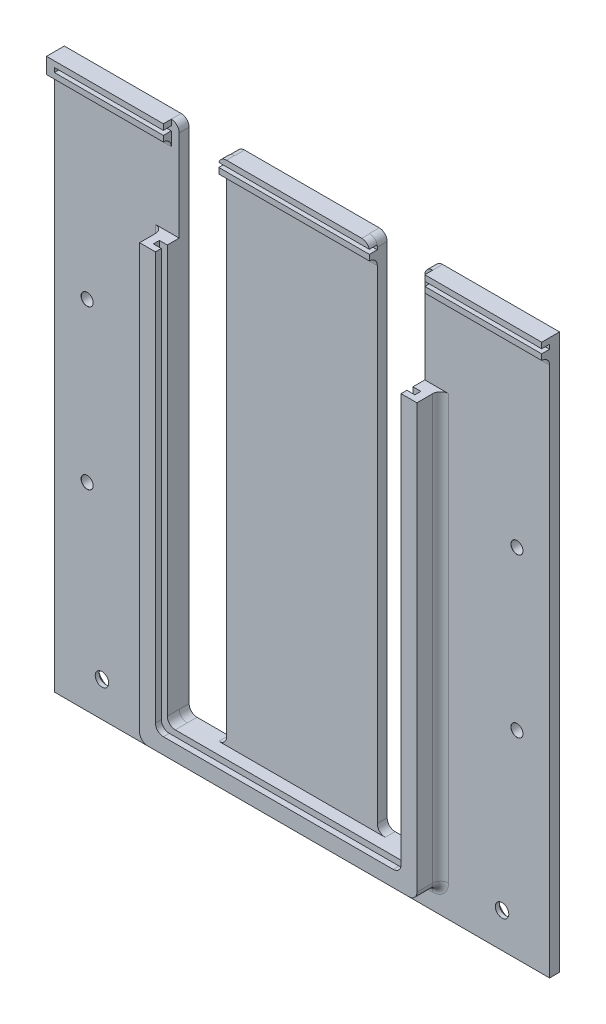
from build123d import *

# Parameters (mm, degrees)
ESBO_O1_W                                    = 125
ESBO_O1_H                                    = 140
RESSALTO_EXTRUS_O1_DEPTH                     = 2.5
RESSALTO_EXTRUS_O2_DEPTH                     = 6
ESBO_O3_W                                    = 1.52
ESBO_O3_H                                    = 105
CORTE_EXTRUS_O1_DEPTH                        = 2
ESBO_O4_W                                    = 1.52
ESBO_O4_H                                    = 105
CORTE_EXTRUS_O2_DEPTH                        = 2
ESBO_O5_W                                    = 66
ESBO_O5_H                                    = 1.52
CORTE_EXTRUS_O3_DEPTH                        = 2
FILETE1_R                                    = 2
FILETE2_R                                    = 2
FILETE3_R                                    = 2
ESBO_O6_W                                    = 12
ESBO_O6_H                                    = 130
CORTE_EXTRUS_O4_DEPTH                        = 138.929522592
FILETE4_R                                    = 2
FILETE5_R                                    = 2
ESBO_O7_W                                    = 19.009766083
ESBO_O7_H                                    = 4
ESBO_O7_W_2                                  = 19
ESBO_O7_W_3                                  = 29.5
RESSALTO_EXTRUS_O3_DEPTH                     = 2
ESBO_O8_W                                    = 123
ESBO_O8_H                                    = 1.1
CORTE_EXTRUS_O5_DEPTH                        = 2
FILETE6_R                                    = 2
FUROS_GUIA_COM_3_0MM1_D                      = 3
FUROS_GUIA_COM_3_0MM1_CSINK_D                = 3.05
FUROS_GUIA_COM_3_0MM1_CSINK_ANGLE            = 90
REBAIXO_PARA_PARAFUSO_COM_CABE_A_PAN_2_COUNT = 2
REBAIXO_PARA_PARAFUSO_COM_CABE_A_PAN_2_PITCH = 101


with BuildPart() as part:
    # Esboço1 → Ressalto-extrusão1 (new body)
    with BuildSketch(Plane.XY):
        with Locations((10.140586838, -47.097815293)):
            Rectangle(ESBO_O1_W, ESBO_O1_H)
    extrude(amount=RESSALTO_EXTRUS_O1_DEPTH)

    # Esboço2 → Ressalto-extrusão2 (add)
    with BuildSketch(Plane.XY.offset(2.5)):
        Polygon((-24.859413162, -2.097815293), (-20.859413162, -2.097815293), (-20.859413162, -107.097815293), (41.140586838, -107.097815293), (41.140586838, -2.097815293), (45.140586838, -2.097815293), (45.140586838, -107.097815293), (45.140586838, -111.097815293), (-24.859413162, -111.097815293), (-24.859413162, -107.097815293), align=None)
    extrude(amount=RESSALTO_EXTRUS_O2_DEPTH)

    # Esboço3 → Corte-extrusão1 (cut)
    with BuildSketch(Plane.ZY.offset(-41.140586838)):
        with Locations((6.26, -54.597815293)):
            Rectangle(ESBO_O3_W, ESBO_O3_H)
    extrude(amount=-CORTE_EXTRUS_O1_DEPTH, mode=Mode.SUBTRACT)

    # Esboço4 → Corte-extrusão2 (cut)
    with BuildSketch(Plane(origin=(-20.859413162, 0, 0), x_dir=(0, 0, -1), z_dir=(1, 0, 0))):
        with Locations((-6.26, -54.597815293)):
            Rectangle(ESBO_O4_W, ESBO_O4_H)
    extrude(amount=-CORTE_EXTRUS_O2_DEPTH, mode=Mode.SUBTRACT)

    # Esboço5 → Corte-extrusão3 (cut)
    with BuildSketch(Plane(origin=(0, -107.097815293, 0), x_dir=(1, 0, 0), z_dir=(0, 1, 0))):
        with Locations((10.140586838, -6.26)):
            Rectangle(ESBO_O5_W, ESBO_O5_H)
    extrude(amount=-CORTE_EXTRUS_O3_DEPTH, mode=Mode.SUBTRACT)

    # Filete1
    filete1_edges = [part.edges().sort_by_distance(p)[0] for p in [
        (41.140586838, -107.097815293, 7.76),
        (-20.859413162, -107.097815293, 7.76),
        (41.140586838, -107.097815293, 4),
        (-20.859413162, -107.097815293, 4),
    ]]
    fillet(filete1_edges, radius=FILETE1_R)

    # Filete2
    filete2_edges = [part.edges().sort_by_distance(p)[0] for p in [
        (-24.859413162, -111.097815293, 5.5),
        (45.140586838, -111.097815293, 5.5),
    ]]
    fillet(filete2_edges, radius=FILETE2_R)

    # Filete3
    filete3_edges = [part.edges().sort_by_distance(p)[0] for p in [
        (10.140586838, -111.097815293, 2.5),
        (-24.273626724, -110.512028855, 2.5),
        (44.5548004, -110.512028855, 2.5),
        (-24.859413162, -55.597815293, 2.5),
        (45.140586838, -55.597815293, 2.5),
    ]]
    fillet(filete3_edges, radius=FILETE3_R)

    # Esboço6 → Corte-extrusão4 (cut, through all)
    with BuildSketch(Plane.XY.offset(2.5)):
        with Locations((-14.859413162, -42.097815293)):
            Rectangle(ESBO_O6_W, ESBO_O6_H)
        with Locations((35.140586838, -42.097815293)):
            Rectangle(ESBO_O6_W, ESBO_O6_H)
    extrude(amount=-CORTE_EXTRUS_O4_DEPTH, mode=Mode.SUBTRACT)

    # Filete4
    filete4_edges = [part.edges().sort_by_distance(p)[0] for p in [
        (-20.859413162, 22.902184707, 1.25),
        (-8.859413162, 22.902184707, 1.25),
        (41.140586838, 22.902184707, 1.25),
        (29.140586838, 22.902184707, 1.25),
    ]]
    fillet(filete4_edges, radius=FILETE4_R)

    # Filete5
    filete5_edges = [part.edges().sort_by_distance(p)[0] for p in [
        (-20.859413162, -107.097815293, 1.25),
        (-8.859413162, -107.097815293, 1.25),
        (41.140586838, -107.097815293, 1.25),
        (29.140586838, -107.097815293, 1.25),
    ]]
    fillet(filete5_edges, radius=FILETE5_R)

    # Esboço7 → Ressalto-extrusão3 (add)
    with BuildSketch(Plane.XY.offset(2.5)):
        with Locations((0.635703797, 20.902184707)):
            Rectangle(ESBO_O7_W, ESBO_O7_H)
        with Locations((19.640586838, 20.902184707)):
            Rectangle(ESBO_O7_W_2, ESBO_O7_H)
        with Locations((-37.609413162, 20.902184707)):
            Rectangle(ESBO_O7_W_3, ESBO_O7_H)
        with Locations((57.890586838, 20.902184707)):
            Rectangle(ESBO_O7_W_3, ESBO_O7_H)
    extrude(amount=RESSALTO_EXTRUS_O3_DEPTH)

    # Esboço8 → Corte-extrusão5 (cut)
    with BuildSketch(Plane.XY.offset(4.5)):
        with Locations((11.140586838, 20.902184707)):
            Rectangle(ESBO_O8_W, ESBO_O8_H)
    extrude(amount=-CORTE_EXTRUS_O5_DEPTH, mode=Mode.SUBTRACT)

    # Filete6
    # the kernel refuses this fillet: 2 mm, written as the material it adds along each edge
    with BuildSketch(Plane(origin=(43.140586838, 18.902184707, 2.5), x_dir=(0, 0, 1), z_dir=(1, 0, 0)), Plane(origin=(-52.359413162, 18.902184707, 2.5), x_dir=(0, 0, 1), z_dir=(1, 0, 0))) as filete6_piece_1:
        with BuildLine():
            CenterArc((FILETE6_R, FILETE6_R), FILETE6_R, 180, 90)
            Line((0, FILETE6_R), (0, 0))
            Line((0, 0), (FILETE6_R, 0))
        make_face()
    extrude(amount=29.5)
    with BuildSketch(Plane(origin=(29.140586838, 18.902184707, 2.5), x_dir=(0, 0, 1), z_dir=(-1, 0, 0))) as filete6_piece_2:
        with BuildLine():
            CenterArc((FILETE6_R, -FILETE6_R), FILETE6_R, 90, 90)
            Line((0, -FILETE6_R), (0, 0))
            Line((0, 0), (FILETE6_R, 0))
        make_face()
    extrude(amount=38)
    # the kernel refuses this fillet: 2 mm, written as the material it takes off along each edge
    with BuildSketch(Plane(origin=(29.140586838, 22.902184707, -2.307221131), x_dir=(-1, 0, 0), z_dir=(0, 0, 1))) as filete6_2_piece_1:
        with BuildLine():
            CenterArc((1.922888452, 2), FILETE6_R, 195.962014163, 74.037985837)
            Line((0, 1.45), (0, 0))
            Line((0, 0), (1.922888452, 0))
        make_face()
    extrude(amount=11.614442262, mode=Mode.SUBTRACT)
    with BuildSketch(Plane(origin=(-8.869179245, 22.902184707, -2.307221131), x_dir=(1, 0, 0), z_dir=(0, 0, 1))) as filete6_2_piece_2:
        with BuildLine():
            CenterArc((1.922888452, -2), FILETE6_R, 90, 74.037985837)
            Line((0, -1.45), (0, 0))
            Line((0, 0), (1.922888452, 0))
        make_face()
    extrude(amount=11.614442262, mode=Mode.SUBTRACT)

    # Furos-guia com Ø3.0mm1 (through all)
    with Locations(Plane.XY.offset(2.5)):
        with Locations((-44.109413162, -27.097815293), (-44.109413162, -67.097815293), (64.390586838, -27.094030717), (64.390586838, -67.094030814)):
            CounterSinkHole(FUROS_GUIA_COM_3_0MM1_D / 2, FUROS_GUIA_COM_3_0MM1_CSINK_D / 2, counter_sink_angle=FUROS_GUIA_COM_3_0MM1_CSINK_ANGLE)

    # Esboço14 → Rebaixo para parafuso com cabeça panela de M31 (revolve, cut)
    with BuildSketch(Plane(origin=(-40.359413162, -108.297815293, 0), x_dir=(0, 1, 0), z_dir=(1, 0, 0))):
        Polygon((0, 0), (0, 8.5), (1.7, 8.5), (1.7, 1.5), (3.5, 1.5), (3.5, 0.025), (3.525, 0), align=None)
    rebaixo_para_parafuso_com_cabe_a_panela = revolve(axis=Axis((-40.359413162, -108.297815293, -6.35), (0, 0, 1)), mode=Mode.SUBTRACT)

    # Rebaixo para parafuso com cabe_a pan 2: Rebaixo para parafuso com cabeça panela de M31 ×2
    with Locations(*[(i * REBAIXO_PARA_PARAFUSO_COM_CABE_A_PAN_2_PITCH, 0, 0) for i in range(1, REBAIXO_PARA_PARAFUSO_COM_CABE_A_PAN_2_COUNT)]):
        add(rebaixo_para_parafuso_com_cabe_a_panela, mode=Mode.SUBTRACT)


solid = part.part
